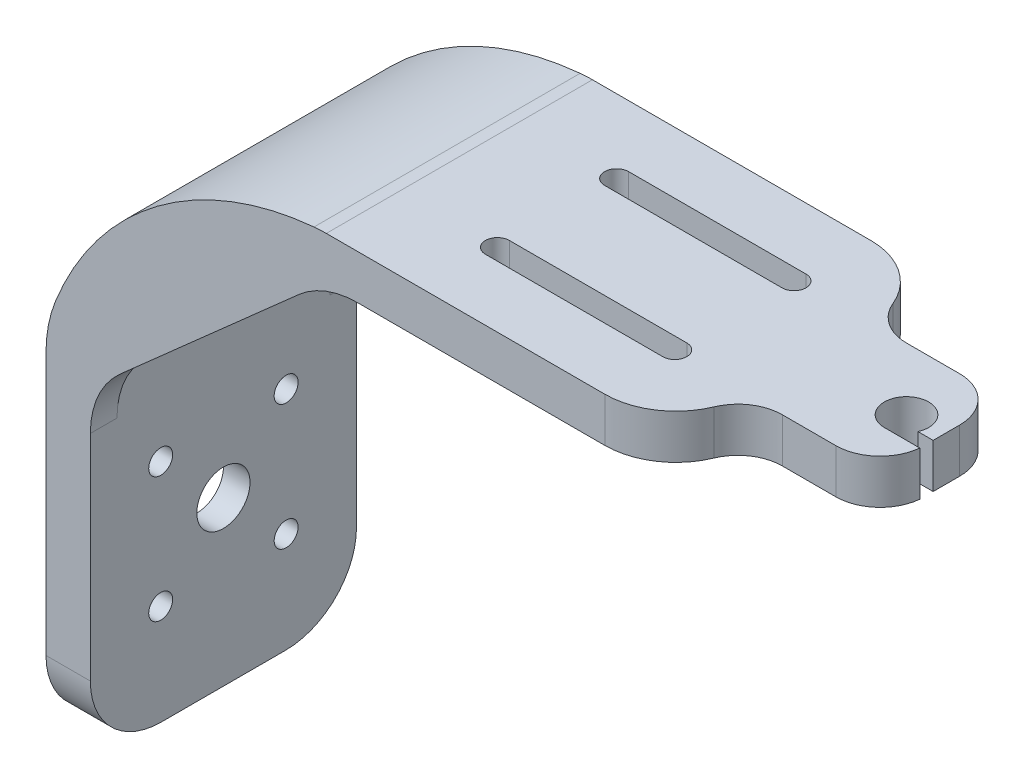
from build123d import *

# Parameters (mm, degrees)
SALIENTE_EXTRUIR1_DEPTH = 30
CORTAR_EXTRUIR1_DEPTH   = 5
CROQUIS3_W              = 30
CROQUIS3_H              = 25
CORTAR_EXTRUIR2_DEPTH   = 2
CROQUIS4_R              = 1.35
CROQUIS4_R_2            = 3
CORTAR_EXTRUIR3_DEPTH   = 5
CROQUIS5_W              = 25
CROQUIS5_H              = 25
CORTAR_EXTRUIR4_DEPTH   = 2
REDONDEO1_R             = 15
REDONDEO2_R             = 8
REDONDEO3_R             = 2.7
SALIENTE_EXTRUIR2_DEPTH = 5
REDONDEO4_R             = 5
SALIENTE_EXTRUIR3_START = -3
SALIENTE_EXTRUIR3_DEPTH = 3
SALIENTE_EXTRUIR4_START = -30
SALIENTE_EXTRUIR4_DEPTH = 3
REDONDEO5_R             = 10


with BuildPart() as part:
    # Croquis1 → Saliente-Extruir1 (new body)
    with BuildSketch(Plane.XY):
        with BuildLine():
            Line((0, 0), (0, 5))
            Line((0, 5), (-40, 5))
            ThreePointArc((-40, 5), (-59.427874629, -2.62943546), (-71, -20))
            Line((-71, -20), (-71, -60))
            Line((-71, -60), (-66, -60))
            Line((-66, -60), (-66, -20.535714286))
            ThreePointArc((-66, -20.535714286), (-56.328368106, -6.472823549), (-40.535714286, 0))
            Line((-40.535714286, 0), (0, 0))
        make_face()
    extrude(amount=SALIENTE_EXTRUIR1_DEPTH)

    # Croquis2 → Cortar-Extruir1 (cut)
    with BuildSketch(Plane(origin=(0, 5, 0), x_dir=(1, 0, 0), z_dir=(0, 1, 0))):
        with BuildLine():
            Line((-18.4, -6.93), (-8.4, -6.93))
            ThreePointArc((-8.4, -6.93), (-7.05, -8.28), (-8.4, -9.63))
            Line((-8.4, -9.63), (-28.4, -9.63))
            ThreePointArc((-28.4, -9.63), (-29.75, -8.28), (-28.4, -6.93))
            Line((-28.4, -6.93), (-18.4, -6.93))
        make_face()
        with BuildLine():
            Line((-8.4, -20.37), (-28.4, -20.37))
            ThreePointArc((-28.4, -20.37), (-29.75, -21.72), (-28.4, -23.07))
            Line((-28.4, -23.07), (-18.4, -23.07))
            Line((-18.4, -23.07), (-8.4, -23.07))
            ThreePointArc((-8.4, -23.07), (-7.05, -21.72), (-8.4, -20.37))
        make_face()
    extrude(amount=-CORTAR_EXTRUIR1_DEPTH, mode=Mode.SUBTRACT)

    # Croquis3 → Cortar-Extruir2 (cut)
    with BuildSketch(Plane.XZ):
        with Locations((-18.4, 15)):
            Rectangle(CROQUIS3_W, CROQUIS3_H)
    extrude(amount=-CORTAR_EXTRUIR2_DEPTH, mode=Mode.SUBTRACT)

    # Croquis4 → Cortar-Extruir3 (cut)
    with BuildSketch(Plane.ZY.offset(71)):
        with Locations((22.071067812, -34.528932188)):
            Circle(CROQUIS4_R)
        with Locations((22.071067812, -48.671067812)):
            Circle(CROQUIS4_R)
        with Locations((7.928932188, -48.671067812)):
            Circle(CROQUIS4_R)
        with Locations((7.928932188, -34.528932188)):
            Circle(CROQUIS4_R)
        with Locations((15, -41.6)):
            Circle(CROQUIS4_R_2)
    extrude(amount=-CORTAR_EXTRUIR3_DEPTH, mode=Mode.SUBTRACT)

    # Croquis5 → Cortar-Extruir4 (cut)
    with BuildSketch(Plane.ZY.offset(71)):
        with Locations((15, -41.6)):
            Rectangle(CROQUIS5_W, CROQUIS5_H)
    extrude(amount=-CORTAR_EXTRUIR4_DEPTH, mode=Mode.SUBTRACT)

    # Redondeo1
    # the kernel refuses this fillet: 15 mm, written as the material it adds along each edge
    with BuildSketch(Plane(origin=(-40.535714286, 0, 0), x_dir=(-0.9928040160487852, -0.11975051447657076, 0), z_dir=(0, 0, 1))) as redondeo1_piece_1:
        with BuildLine():
            CenterArc((0.928120739, 14.996773606), REDONDEO1_R, 263.122295715, 8.066092884)
            Line((-0.868136978, 0.104713365), (0, 0))
            ThreePointArc((0, 0), (0.61960892, -0.006425976), (1.23921784, 0))
        make_face()
    extrude(amount=30)
    with BuildSketch(Plane(origin=(-66, -20.535714286, 0), x_dir=(0, -1, 0), z_dir=(0, 0, 1))) as redondeo1_piece_2:
        with BuildLine():
            CenterArc((2.787806423, 15), REDONDEO1_R, 244.497181261, 25.502818739)
            ThreePointArc((-3.670526079, 1.461538444), (-1.859449277, 0.670027601), (0, 0))
            Line((0, 0), (2.787806423, 0))
        make_face()
    extrude(amount=30)
    # the kernel refuses this fillet: 15 mm, written as the material it takes off along each edge
    with BuildSketch(Plane(origin=(-71, -20, -8.10538424), x_dir=(0, -1, 0), z_dir=(0, 0, 1))) as redondeo1_2_piece_1:
        with BuildLine():
            CenterArc((2.445891068, 15), REDONDEO1_R, 248.435113489, 21.564886511)
            ThreePointArc((-3.067429039, 1.049971276), (-1.545944268, 0.48925715), (0, 0))
            Line((0, 0), (2.445891068, 0))
        make_face()
    extrude(amount=46.210768479, mode=Mode.SUBTRACT)
    with BuildSketch(Plane(origin=(-40, 5, -1.977224952), x_dir=(-0.9967130662310812, -0.08101273729628075, 0), z_dir=(0, 0, 1))) as redondeo1_2_piece_2:
        with BuildLine():
            CenterArc((0.620502289, 14.999032237), REDONDEO1_R, 265.35321973, 5.297627307)
            Line((-0.59468877, 0.048336243), (0, 0))
            ThreePointArc((0, 0), (0.39544499, -0.002246038), (0.790889981, 0))
        make_face()
    extrude(amount=33.954449904, mode=Mode.SUBTRACT)

    # Redondeo2
    redondeo2_edges = [part.edges().sort_by_distance(p)[0] for p in [
        (0, 2.5, 0),
        (-68.5, -60, 30),
        (0, 2.5, 30),
        (-68.5, -60, 0),
    ]]
    fillet(redondeo2_edges, radius=REDONDEO2_R)

    # Redondeo3
    redondeo3_edges = [part.edges().sort_by_distance(p)[0] for p in [
        (-70, -29.1, 27.5),
        (-70, -54.1, 27.5),
        (-70, -54.1, 2.5),
        (-70, -29.1, 2.5),
        (-3.4, 1, 27.5),
        (-3.4, 1, 2.5),
        (-33.4, 1, 2.5),
        (-33.4, 1, 27.5),
    ]]
    fillet(redondeo3_edges, radius=REDONDEO3_R)

    # Croquis6 → Saliente-Extruir2 (add)
    with BuildSketch(Plane.XZ):
        with BuildLine():
            Line((0, 22), (0, 8))
            Line((0, 8), (15, 8))
            Line((15, 8), (15, 16))
            Line((15, 16), (13.291287847, 16))
            ThreePointArc((13.291287847, 16), (9.630693606, 12.908349934), (11, 17.5))
            Line((11, 17.5), (15, 17.5))
            Line((15, 17.5), (15, 22))
            Line((15, 22), (0, 22))
        make_face()
    extrude(amount=-SALIENTE_EXTRUIR2_DEPTH)

    # Redondeo4
    # the kernel refuses this fillet: 5 mm, written as the material it adds along each edge
    with BuildSketch(Plane(origin=(0, 0, 22), x_dir=(-0.19611613513818366, 0, 0.9805806756909203), z_dir=(0, 1, 0))) as redondeo4_piece_1:
        with BuildLine():
            CenterArc((4.118438838, 4.902903378), REDONDEO4_R, 191.309932474, 67.380135052)
            Line((-0.784464541, 3.922322703), (0, 0))
            ThreePointArc((0, 0), (1.568929081, 0.155354594), (3.137858162, 0))
        make_face()
    extrude(amount=5)
    with BuildSketch(Plane(origin=(0, 0, 8), x_dir=(-0.19611613513818402, 0, -0.9805806756909201), z_dir=(0, 1, 0))) as redondeo4_piece_2:
        with BuildLine():
            CenterArc((4.118438838, -4.902903378), REDONDEO4_R, 101.309932474, 67.380135052)
            Line((-0.784464541, -3.922322703), (0, 0))
            ThreePointArc((0, 0), (1.568929081, -0.155354594), (3.137858162, 0))
        make_face()
    extrude(amount=5)
    # the kernel refuses this fillet: 5 mm, written as the material it takes off along each edge
    with BuildSketch(Plane(origin=(15, -12.437342964, 22), x_dir=(-1, 0, 0), z_dir=(0, 1, 0))) as redondeo4_2_piece_1:
        with BuildLine():
            CenterArc((4.974937186, -5), REDONDEO4_R, 90, 84.260829523)
            Line((0, -4.5), (0, 0))
            Line((0, 0), (4.974937186, 0))
        make_face()
    extrude(amount=29.874685928, mode=Mode.SUBTRACT)
    with BuildSketch(Plane(origin=(15, -12.5, 8), x_dir=(0, 0, 1), z_dir=(0, 1, 0))) as redondeo4_2_piece_2:
        with BuildLine():
            CenterArc((REDONDEO4_R, -REDONDEO4_R), REDONDEO4_R, 90, 90)
            Line((0, -REDONDEO4_R), (0, 0))
            Line((0, 0), (REDONDEO4_R, 0))
        make_face()
    extrude(amount=30, mode=Mode.SUBTRACT)

    # Croquis9 → Saliente-Extruir3 (add)
    with BuildSketch(Plane.XY.offset(30).offset(SALIENTE_EXTRUIR3_START)):
        with BuildLine():
            Line((-66, -23.323520708), (-39.661284928, 0))
            ThreePointArc((-39.661284928, 0), (-40.716262324, -0.037145236), (-41.766014734, -0.148396974))
            ThreePointArc((-41.766014734, -0.148396974), (-55.25292739, -5.645128922), (-64.538461556, -16.865188206))
            ThreePointArc((-64.538461556, -16.865188206), (-65.630053372, -20.01269931), (-66, -23.323520708))
        make_face()
    extrude(amount=SALIENTE_EXTRUIR3_DEPTH)

    # Croquis9<2> → Saliente-Extruir4 (add)
    with BuildSketch(Plane.XY.offset(30).offset(SALIENTE_EXTRUIR4_START)):
        with BuildLine():
            Line((-66, -23.323520708), (-39.661284928, 0))
            ThreePointArc((-39.661284928, 0), (-40.716262324, -0.037145236), (-41.766014734, -0.148396974))
            ThreePointArc((-41.766014734, -0.148396974), (-55.25292739, -5.645128922), (-64.538461556, -16.865188206))
            ThreePointArc((-64.538461556, -16.865188206), (-65.630053372, -20.01269931), (-66, -23.323520708))
        make_face()
    extrude(amount=SALIENTE_EXTRUIR4_DEPTH)

    # Redondeo5
    redondeo5_edges = [part.edges().sort_by_distance(p)[0] for p in [
        (-39.661284928, 0, 28.5),
        (-66, -23.323520708, 1.5),
        (-66, -23.323520708, 28.5),
        (-39.661284928, 0, 1.5),
    ]]
    fillet(redondeo5_edges, radius=REDONDEO5_R)


solid = part.part
